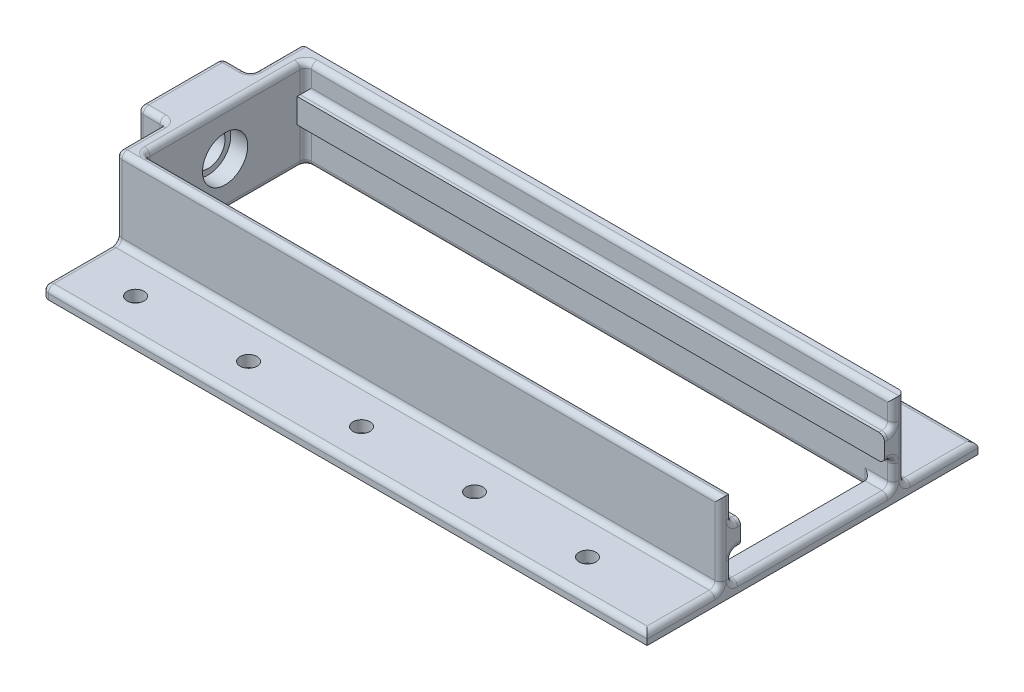
from build123d import *

# Parameters (mm, degrees)
SKETCH1_W               = 107
SKETCH1_H               = 58.58
BOSS_EXTRUDE1_DEPTH     = 16
SKETCH2_W               = 100
SKETCH2_H               = 28.58
CUT_EXTRUDE1_DEPTH      = 16
SKETCH3_W               = 107
SKETCH3_H               = 13
SKETCH3_W_2             = 4
SKETCH3_H_2             = 28.58
CUT_EXTRUDE2_DEPTH      = 14
SKETCH4_W               = 15
SKETCH4_H               = 16
SKETCH4_R               = 3
BOSS_EXTRUDE2_DEPTH     = 5
SKETCH6_W               = 107
SKETCH6_H               = 4.36
BOSS_EXTRUDE3_DEPTH     = 1.54
LPATTERN1_COUNT         = 2
LPATTERN1_PITCH         = 27.04
FILLET1_R               = 1
SKETCH8_R               = 4
CUT_EXTRUDE3_DEPTH      = 5
CUT_EXTRUDE4_DEPTH      = 69.267707228
CUT_EXTRUDE4_DEPTH_BACK = 69.267707228
SKETCH9_R               = 1.5


with BuildPart() as part:
    # Sketch1 → Boss-Extrude1 (new body)
    with BuildSketch(Plane(origin=(0, 0, 0), x_dir=(1, 0, 0), z_dir=(0, 1, 0))):
        with Locations((5.06, -2.884621212)):
            Rectangle(SKETCH1_W, SKETCH1_H)
    extrude(amount=BOSS_EXTRUDE1_DEPTH)

    # Sketch2 → Cut-Extrude1 (cut)
    with BuildSketch(Plane(origin=(0, 16, 0), x_dir=(1, 0, 0), z_dir=(0, 1, 0))):
        with Locations((4.56, -2.884621212)):
            Rectangle(SKETCH2_W, SKETCH2_H)
    extrude(amount=-CUT_EXTRUDE1_DEPTH, mode=Mode.SUBTRACT)

    # Sketch3 → Cut-Extrude2 (cut)
    with BuildSketch(Plane(origin=(0, 16, 0), x_dir=(1, 0, 0), z_dir=(0, 1, 0))):
        with Locations((5.06, 19.905378788)):
            Rectangle(SKETCH3_W, SKETCH3_H)
        with Locations((5.06, -25.674621212)):
            Rectangle(SKETCH3_W, SKETCH3_H)
        with Locations((56.56, -2.884621212)):
            Rectangle(SKETCH3_W_2, SKETCH3_H_2)
    extrude(amount=-CUT_EXTRUDE2_DEPTH, mode=Mode.SUBTRACT)

    # Sketch4 → Boss-Extrude2 (add)
    with BuildSketch(Plane.ZY.offset(48.44)):
        with Locations((2.884621212, 8)):
            Rectangle(SKETCH4_W, SKETCH4_H)
        with Locations((2.884621212, 8)):
            Circle(SKETCH4_R, mode=Mode.SUBTRACT)
    extrude(amount=BOSS_EXTRUDE2_DEPTH)

    # Sketch6 → Boss-Extrude3 (add)
    with BuildSketch(Plane(origin=(0, 0, 17.174621212), x_dir=(-1, 0, 0), z_dir=(0, 0, -1))):
        with Locations((-5.06, 9)):
            Rectangle(SKETCH6_W, SKETCH6_H)
    boss_extrude3 = extrude(amount=BOSS_EXTRUDE3_DEPTH)

    # LPattern1: Boss-Extrude3 ×2
    with Locations(*[(0, 0, -i * LPATTERN1_PITCH) for i in range(1, LPATTERN1_COUNT)]):
        add(boss_extrude3)

    # Fillet1
    fillet1_edges = [part.edges().sort_by_distance(p)[0] for p in [
        (58.56, 6.82, -10.635378788),
        (-45.44, 16, 2.884621212),
        (58.56, 11.18, -10.635378788),
        (-45.44, 0, 2.884621212),
        (54.56, 0, 2.884621212),
        (58.56, 2, 2.884621212),
        (58.56, 6.82, 16.404621212),
        (58.56, 4.41, -11.405378788),
        (56.56, 2, -11.405378788),
        (54.56, 1, -11.405378788),
        (4.56, 0, -11.405378788),
        (-45.44, 3.41, -11.405378788),
        (6.56, 6.82, -11.405378788),
        (-45.44, 13.59, -11.405378788),
        (6.56, 16, -11.405378788),
        (58.56, 13.59, -11.405378788),
        (6.56, 11.18, -11.405378788),
        (-45.44, 3.41, 17.174621212),
        (4.56, 0, 17.174621212),
        (54.56, 1, 17.174621212),
        (56.56, 2, 17.174621212),
        (58.56, 4.41, 17.174621212),
        (6.56, 6.82, 17.174621212),
        (5.06, 2, 19.174621212),
        (58.56, 11.18, 16.404621212),
        (-50.94, 16, 10.384621212),
        (-50.94, 0, 10.384621212),
        (-50.94, 0, -4.615378788),
        (-50.94, 16, -4.615378788),
        (58.56, 9, -13.405378788),
        (58.56, 9, 19.174621212),
        (5.06, 16, 19.174621212),
        (58.56, 2, 25.674621212),
        (5.06, 2, 32.174621212),
        (58.56, 13.59, 17.174621212),
        (6.56, 16, 17.174621212),
        (-45.44, 13.59, 17.174621212),
        (6.56, 11.18, 17.174621212),
        (-48.44, 16, 14.779621212),
        (-48.44, 9, 19.174621212),
        (-48.44, 2, 25.674621212),
        (-48.44, 1, 32.174621212),
        (-48.44, 0, 21.279621212),
        (-48.44, 8, 10.384621212),
        (-53.44, 8, -0.115378788),
        (-53.44, 16, 2.884621212),
        (-53.44, 8, 10.384621212),
        (-53.44, 0, 2.884621212),
        (-53.44, 8, -4.615378788),
        (-48.44, 0, -15.510378788),
        (-48.44, 1, -26.405378788),
        (-48.44, 9, -13.405378788),
        (-48.44, 16, -9.010378788),
        (-48.44, 8, -4.615378788),
        (5.06, 2, -26.405378788),
        (58.56, 2, -19.905378788),
        (5.06, 2, -13.405378788),
        (-48.44, 2, -19.905378788),
    ]]
    fillet(fillet1_edges, radius=FILLET1_R - 0.0001)  # a hair under: the kernel refuses the full size

    # Sketch8 → Cut-Extrude3 (cut)
    with BuildSketch(Plane.ZY.offset(48.44)):
        with Locations((2.884621212, 8)):
            Circle(SKETCH8_R)
    extrude(amount=-CUT_EXTRUDE3_DEPTH, mode=Mode.SUBTRACT)

    # Sketch9 → Cut-Extrude4 (cut, two sides: drawn at the far end of the back side and taken through both)
    with BuildSketch(Plane(origin=(0, 2, 0), x_dir=(1, 0, 0), z_dir=(0, 1, 0)).offset(-CUT_EXTRUDE4_DEPTH_BACK)):
        with Locations(Location((-38.295107849, 20.106406235, 0), (0, 0, 270))):
            Circle(SKETCH9_R)
        with Locations(Location((-18.295107849, 20.106406235, 0), (0, 0, 270))):
            Circle(SKETCH9_R)
        with Locations(Location((1.704892151, 20.106406235, 0), (0, 0, 270))):
            Circle(SKETCH9_R)
        with Locations(Location((21.704892151, 20.106406235, 0), (0, 0, 270))):
            Circle(SKETCH9_R)
        with Locations(Location((41.704892151, 20.106406235, 0), (0, 0, 270))):
            Circle(SKETCH9_R)
        with Locations(Location((41.704892151, -25.87564866, 0), (0, 0, 270))):
            Circle(SKETCH9_R)
        with Locations(Location((21.704892151, -25.87564866, 0), (0, 0, 270))):
            Circle(SKETCH9_R)
        with Locations(Location((1.704892151, -25.87564866, 0), (0, 0, 270))):
            Circle(SKETCH9_R)
        with Locations(Location((-18.295107849, -25.87564866, 0), (0, 0, 270))):
            Circle(SKETCH9_R)
        with Locations(Location((-38.295107849, -25.87564866, 0), (0, 0, 270))):
            Circle(SKETCH9_R)
    extrude(amount=CUT_EXTRUDE4_DEPTH + CUT_EXTRUDE4_DEPTH_BACK, mode=Mode.SUBTRACT)


solid = part.part
